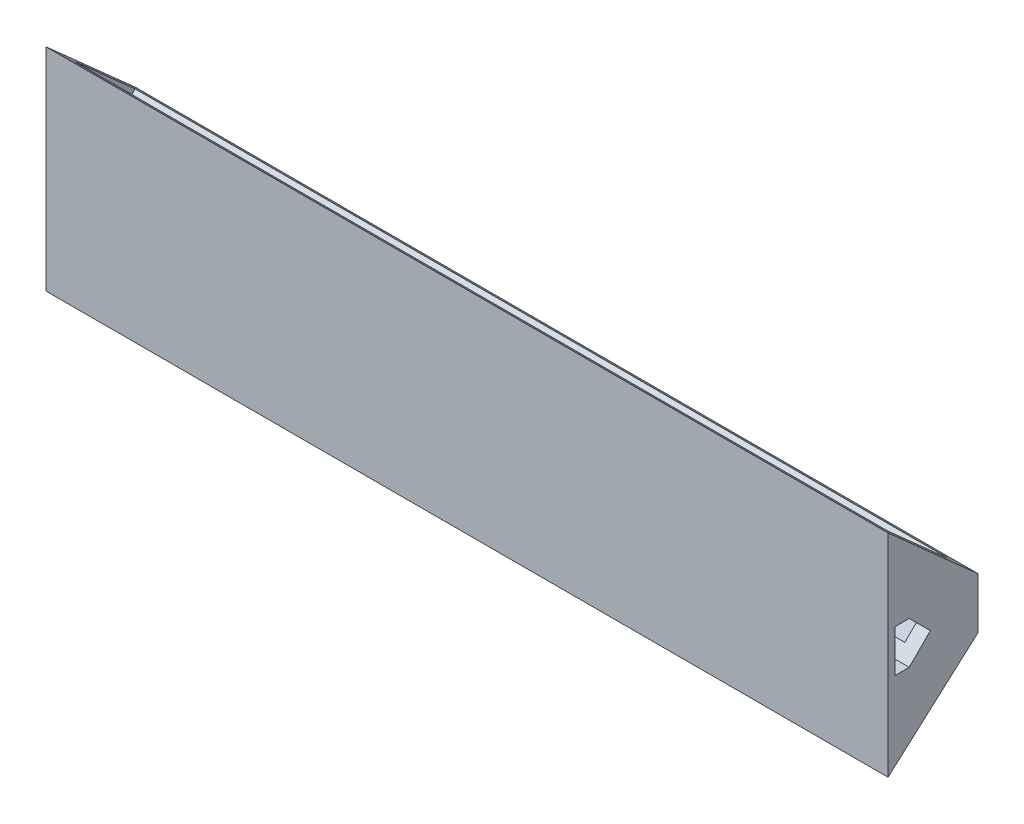
from build123d import *

# Parameters (mm, degrees)
BOSS_EXTRUDE1_DEPTH      = 119.4
BOSS_EXTRUDE1_DEPTH_BACK = 119.4
SKETCH1_W                = 230.8
SKETCH1_H                = 6.5
CUT_EXTRUDE1_DEPTH       = 20
SHELL1_START             = -115.4
SHELL1_DEPTH             = 230.8
CHAMFER1_SIZE            = 4


# Read off the part's stored shape, not the designer's step: Shell1
with BuildPart() as part:
    # Sketch4 → Boss-Extrude1 (new, two sides: drawn at the far end of the back side and taken through both)
    with BuildSketch(Plane(origin=(0, 0, 0), x_dir=(0, 0, -1), z_dir=(1, 0, 0)).offset(-BOSS_EXTRUDE1_DEPTH_BACK)):
        Polygon((0, 7.25), (-25.5, 30), (-25.5, -30), (0, -7.25), align=None)
        Polygon((-23.5, 6), (-23.5, -6), (-19.5, -6), (-13.5, 0), (-19.5, 6), align=None, mode=Mode.SUBTRACT)
    extrude(amount=BOSS_EXTRUDE1_DEPTH + BOSS_EXTRUDE1_DEPTH_BACK)

    # Sketch1 → Cut-Extrude1 (cut)
    with BuildSketch(Plane.XY):
        Rectangle(SKETCH1_W, SKETCH1_H)
    extrude(amount=CUT_EXTRUDE1_DEPTH, mode=Mode.SUBTRACT)

    # Shell1 outline → Shell1 (cut)
    with BuildSketch(Plane.YZ.offset(SHELL1_START)):
        Polygon((-10, 21.5), (-26.431372549, 21.5), (-10.818627451, 4), (-7.25, 4), (-7.25, 15.093145751), (-10, 17.843145751), align=None)
        Polygon((26.431372549, 21.5), (10, 21.5), (10, 17.843145751), (7.25, 15.093145751), (7.25, 4), (10.818627451, 4), align=None)
    extrude(amount=SHELL1_DEPTH, mode=Mode.SUBTRACT)

    # Chamfer1
    # the kernel refuses this chamfer: 4 mm, written as the material it adds along each edge
    with BuildSketch(Plane(origin=(-115.4, -7.25, 4), x_dir=(0, -0.9996219169112968, -0.02749587661058638), z_dir=(1, 0, 0))) as chamfer1_piece_1_section:
        Polygon((CHAMFER1_SIZE * 0.999621916911, -CHAMFER1_SIZE * 0.0274958766106), (-CHAMFER1_SIZE * 0.0274958766106, -CHAMFER1_SIZE * 0.999621916911), (0, 0), align=None)
    chamfer1_piece_1 = extrude(amount=230.8, mode=Mode.PRIVATE)
    chamfer1_piece_1 = split(chamfer1_piece_1, bisect_by=Plane(origin=(0, -10.469830587, 3.609040878), z_dir=(0, 0.7461972096049123, 0.6657249615102642)), keep=Keep.TOP, mode=Mode.PRIVATE)
    add(chamfer1_piece_1)
    with BuildSketch(Plane(origin=(-115.4, 7.25, 4), x_dir=(0, 0.9996219169112968, -0.02749587661058638), z_dir=(1, 0, 0))) as chamfer1_piece_2_section:
        Polygon((CHAMFER1_SIZE * 0.999621916911, CHAMFER1_SIZE * 0.0274958766106), (-CHAMFER1_SIZE * 0.0274958766106, CHAMFER1_SIZE * 0.999621916911), (0, 0), align=None)
    chamfer1_piece_2 = extrude(amount=230.8, mode=Mode.PRIVATE)
    chamfer1_piece_2 = split(chamfer1_piece_2, bisect_by=Plane(origin=(0, 10.469830587, 3.609040878), z_dir=(0, -0.7461972096049116, 0.6657249615102648)), keep=Keep.TOP, mode=Mode.PRIVATE)
    add(chamfer1_piece_2)


solid = part.part
